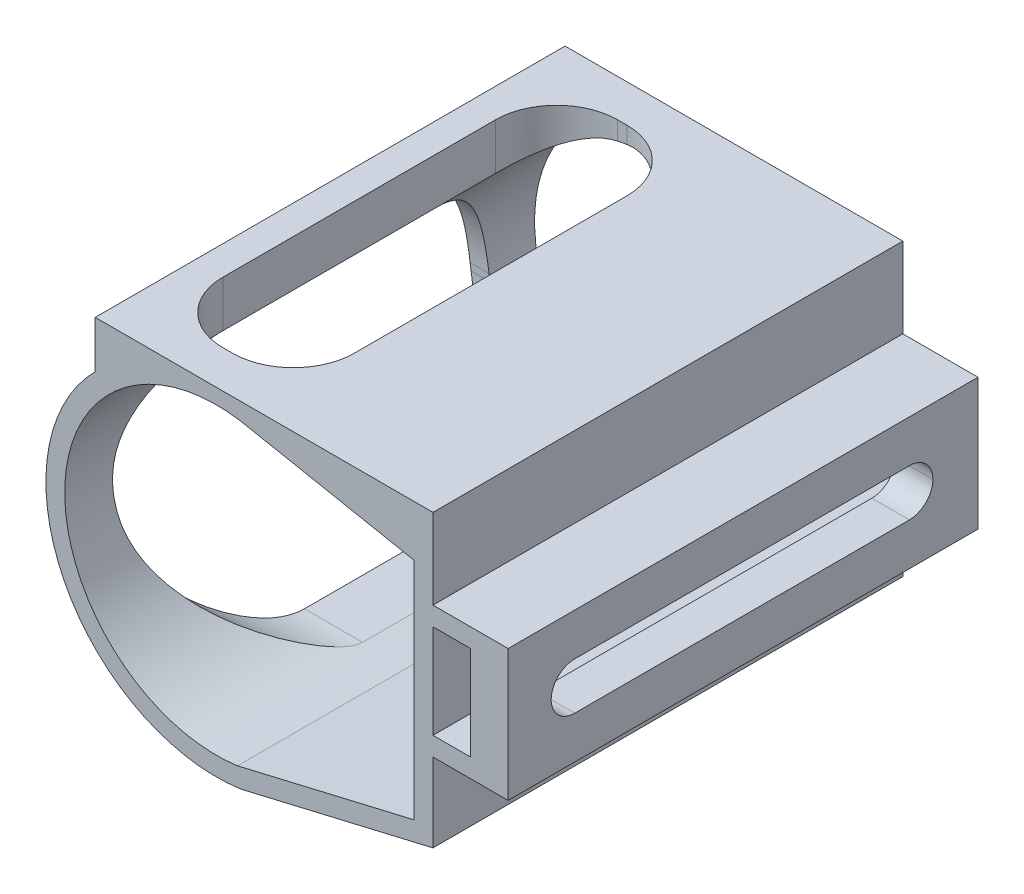
from build123d import *
from OCP.BRepAlgoAPI import BRepAlgoAPI_Cut
from OCP.TopTools import TopTools_ListOfShape

# Parameters (mm, degrees)
SALIENTE_EXTRUIR1_DEPTH     = 50
SALIENTE_EXTRUIR2_DEPTH     = 50
CORTAR_EXTRUIR12_REACH      = 77.399
REDONDEO1_R                 = 2.5
CORTAR_EXTRUIR17_REACH      = 77.931
CORTAR_EXTRUIR17_END_RADIUS = 16.15
CORTAR_EXTRUIR19_REACH      = 79.662
CROQUIS18_W                 = 7
CROQUIS18_H                 = 42
CORTAR_EXTRUIR22_REACH      = 79.662
CORTAR_EXTRUIR22_END_RADIUS = 16.15
CROQUIS22_W                 = 7
CROQUIS22_H                 = 42
REDONDEO10_START            = 3.308867588
REDONDEO10_DEPTH            = 4.936164621
REDONDEO10_START_2          = 6.105712769
REDONDEO10_2_DEPTH          = 2.13931944
REDONDEO10_START_3          = 4
REDONDEO10_3_DEPTH          = 42


with BuildPart() as part:
    # Croquis3 → Saliente-Extruir1 (new body)
    with BuildSketch(Plane.XY):
        with BuildLine():
            Line((-42.099195701, 8.245032209), (-6.157247249, 8.245032209))
            Line((-6.157247249, 8.245032209), (-6.157247249, -22.679560551))
            Line((-6.157247249, -22.679560551), (-26.590955846, -27.481197975))
            ThreePointArc((-26.590955846, -27.481197975), (-45.398833914, -17.697170572), (-42.099195701, 3.245032209))
            Line((-42.099195701, 3.245032209), (-42.099195701, 8.245032209))
        make_face()
        with BuildLine():
            Line((-8.157247249, 2.82108494), (-26.731262437, 6.441781026))
            ThreePointArc((-26.731262437, 6.441781026), (-45.345288804, -9.402744466), (-26.961453667, -25.513783269))
            Line((-26.961453667, -25.513783269), (-8.157247249, -21.095056202))
            Line((-8.157247249, -21.095056202), (-8.157247249, 2.82108494))
        make_face(mode=Mode.SUBTRACT)
    extrude(amount=SALIENTE_EXTRUIR1_DEPTH)

    # Croquis11 → Saliente-Extruir2 (add)
    with BuildSketch(Plane(origin=(0, 0, 0), x_dir=(-1, 0, 0), z_dir=(0, 0, -1))):
        Polygon((-1.842752751, -14.302804028), (-1.842752751, -0.302804028), (6.157247249, -0.302804028), (6.157247249, -2.302804028), (2.157247249, -2.302804028), (2.157247249, -12.302804028), (6.157247249, -12.302804028), (6.157247249, -14.302804028), align=None)
    extrude(amount=-SALIENTE_EXTRUIR2_DEPTH)

    # Cortar-Extruir12: up to this face of the body (flat: up to its plane)
    cortar_extruir12_end = Plane(part.part.faces().sort_by_distance((-8.157247249, -9.136985631, 25))[0])
    # Croquis12 → Cortar-Extruir12 (cut, up to the picked face)
    with BuildSketch(Plane(origin=(1.842752751, 0, 0), x_dir=(0, 0, -1), z_dir=(1, 0, 0)), mode=Mode.PRIVATE) as cortar_extruir12_sk1:
        Polygon((-25, -9.802804028), (-4.8, -9.802804028), (-4.8, -4.802804028), (-45.42287301, -4.802804028), (-45.42287301, -9.802804028), align=None)
    cortar_extruir12_tool1 = split(extrude(cortar_extruir12_sk1.sketch, amount=-CORTAR_EXTRUIR12_REACH, mode=Mode.PRIVATE), bisect_by=cortar_extruir12_end, keep=Keep.BOTH, mode=Mode.PRIVATE)
    add(cortar_extruir12_tool1.solids().sort_by(Axis((1.842753, -7.302804, 25.111437), (-1, 0, 0)))[0], mode=Mode.SUBTRACT)

    # Redondeo1
    redondeo1_edges = [part.edges().sort_by_distance(p)[0] for p in [
        (-0.157247249, -4.802804028, 4.8),
        (-0.157247249, -9.802804028, 4.8),
        (-0.157247249, -9.802804028, 45.42287301),
        (-0.157247249, -4.802804028, 45.42287301),
        (-7.157247249, -9.802804028, 4.8),
        (-7.157247249, -4.802804028, 4.8),
        (-7.157247249, -9.802804028, 45.42287301),
        (-7.157247249, -4.802804028, 45.42287301),
    ]]
    fillet(redondeo1_edges, radius=REDONDEO1_R - 0.0001)  # a hair under: the kernel refuses the full size

    # Cortar-Extruir17: up to this cylinder (the profile starts outside it)
    cortar_extruir17_end = Plane(origin=(-29.1957078, -9.519077631, 25), z_dir=(0, 0, -1)) * Cylinder(CORTAR_EXTRUIR17_END_RADIUS, 189.162, mode=Mode.PRIVATE)
    # Croquis16 → Cortar-Extruir17 (cut, up to the surface)
    with BuildSketch(Plane.ZY.offset(48.157247249), mode=Mode.PRIVATE) as cortar_extruir17_sk1:
        with BuildLine():
            Line((32, -25.481197975), (18, -25.481197975))
            ThreePointArc((18, -25.481197975), (8.807611845, -21.67358613), (5, -12.481197975))
            Line((5, -12.481197975), (5, -11.754967791))
            ThreePointArc((5, -11.754967791), (8.807611845, -2.562579636), (18, 1.245032209))
            Line((18, 1.245032209), (32, 1.245032209))
            ThreePointArc((32, 1.245032209), (41.192388155, -2.562579636), (45, -11.754967791))
            Line((45, -11.754967791), (45, -12.481197975))
            ThreePointArc((45, -12.481197975), (41.192388155, -21.67358613), (32, -25.481197975))
        make_face()
    cortar_extruir17_tool1 = extrude(cortar_extruir17_sk1.sketch, amount=-CORTAR_EXTRUIR17_REACH, mode=Mode.PRIVATE) - cortar_extruir17_end
    add(cortar_extruir17_tool1.solids().sort_by_distance((-48.157247, -12.118083, 25))[0], mode=Mode.SUBTRACT)

    # Croquis18 → Cortar-Extruir19 (cut, up to next)
    with BuildSketch(Plane(origin=(0, 8.245032209, 0), x_dir=(1, 0, 0), z_dir=(0, 1, 0)), mode=Mode.PRIVATE) as cortar_extruir19_sk1:
        with Locations((-28.507247249, -25)):
            Rectangle(CROQUIS18_W, CROQUIS18_H)
    cortar_extruir19_tool1 = extrude(cortar_extruir19_sk1.sketch, amount=-CORTAR_EXTRUIR19_REACH, mode=Mode.PRIVATE) & part.part
    add(cortar_extruir19_tool1.solids().sort_by_distance((-28.507247, 8.245032, 25))[0], mode=Mode.SUBTRACT)

    # Cortar-Extruir22: up to this cylinder (the profile starts outside it)
    cortar_extruir22_end = Plane(origin=(-29.1957078, -9.519077631, 25), z_dir=(0, 0, -1)) * Cylinder(CORTAR_EXTRUIR22_END_RADIUS, 192.624, mode=Mode.PRIVATE)
    # Croquis22 → Cortar-Extruir22 (cut, up to the surface)
    with BuildSketch(Plane(origin=(0, 8.245032209, 0), x_dir=(1, 0, 0), z_dir=(0, 1, 0)), mode=Mode.PRIVATE) as cortar_extruir22_sk1:
        with Locations((-35.507247249, -25)):
            Rectangle(CROQUIS22_W, CROQUIS22_H)
    cortar_extruir22_tool1 = extrude(cortar_extruir22_sk1.sketch, amount=-CORTAR_EXTRUIR22_REACH, mode=Mode.PRIVATE) - cortar_extruir22_end
    add(cortar_extruir22_tool1.solids().sort_by_distance((-35.507247, 8.245032, 25))[0], mode=Mode.SUBTRACT)


with BuildPart() as redondeo10_tool:
    # Redondeo10: read off the stored shape, not the designer's step
    # Redondeo10 outline → Redondeo10 (new body)
    with BuildSketch(Plane(origin=(0, 0, 0), x_dir=(1, 0, 0), z_dir=(0, 1, 0)).offset(REDONDEO10_START)):
        with BuildLine():
            Line((-39.007247249, -4), (-39.007247249, -10.5))
            ThreePointArc((-39.007247249, -10.5), (-37.103441327, -5.903805922), (-32.507247249, -4))
            Line((-32.507247249, -4), (-39.007247249, -4))
        make_face()
        with BuildLine():
            ThreePointArc((-32.507247249, -46), (-37.103441327, -44.096194078), (-39.007247249, -39.5))
            Line((-39.007247249, -39.5), (-39.007247249, -46))
            Line((-39.007247249, -46), (-32.507247249, -46))
        make_face()
    extrude(amount=REDONDEO10_DEPTH)


with BuildPart() as part_1:
    add(part.part)


with BuildPart() as part_2:
    # Redondeo10: joined with redondeo10_tool
    add(part_1.part.fuse(redondeo10_tool.part, tol=0.00001))


with BuildPart() as redondeo10_2_tool:
    # Redondeo10 2 outline → Redondeo10 2 (new body)
    with BuildSketch(Plane(origin=(0, 0, 0), x_dir=(1, 0, 0), z_dir=(0, 1, 0)).offset(REDONDEO10_START_2)):
        with BuildLine():
            Line((-25.007247249, -4), (-31.507247249, -4))
            ThreePointArc((-31.507247249, -4), (-26.911053171, -5.903805922), (-25.007247249, -10.5))
            Line((-25.007247249, -10.5), (-25.007247249, -4))
        make_face()
        with BuildLine():
            ThreePointArc((-25.007247249, -39.5), (-26.911053171, -44.096194078), (-31.507247249, -46))
            Line((-31.507247249, -46), (-25.007247249, -46))
            Line((-25.007247249, -46), (-25.007247249, -39.5))
        make_face()
    extrude(amount=REDONDEO10_2_DEPTH)


with BuildPart() as part_3:
    add(part_2.part)


with BuildPart() as part_4:
    # Redondeo10 2: joined with redondeo10_2_tool
    add(part_3.part.fuse(redondeo10_2_tool.part, tol=0.00001))


with BuildPart() as redondeo10_3_tool:
    # Redondeo10 3 outline → Redondeo10 3 (new body)
    with BuildSketch(Plane.XY.offset(REDONDEO10_START_3)):
        with BuildLine():
            Line((-39.007247249, 3.308868177), (-32.507247249, 3.308867588))
            Line((-32.507247249, 3.308867588), (-32.507247249, 6.287762866))
            ThreePointArc((-32.507247249, 6.287762866), (-35.924173697, 5.162551934), (-39.007247249, 3.308868177))
        make_face()
        with BuildLine():
            Line((-31.507247249, 6.105712769), (-25.007247249, 6.105712769))
            Line((-25.007247249, 6.105712769), (-26.731262437, 6.441781026))
            ThreePointArc((-26.731262437, 6.441781026), (-29.118405097, 6.630737362), (-31.507247249, 6.464641754))
            Line((-31.507247249, 6.464641754), (-31.507247249, 6.105712769))
        make_face()
    extrude(amount=REDONDEO10_3_DEPTH)


with BuildPart() as part_5:
    add(part_4.part)

    # Redondeo10 3: cut by redondeo10_3_tool, with a tolerance
    redondeo10_3_stock = TopTools_ListOfShape()
    redondeo10_3_stock.Append(part_5.part.wrapped)
    redondeo10_3_tools = TopTools_ListOfShape()
    redondeo10_3_tools.Append(redondeo10_3_tool.part.wrapped)
    redondeo10_3_cut = BRepAlgoAPI_Cut()
    redondeo10_3_cut.SetArguments(redondeo10_3_stock)
    redondeo10_3_cut.SetTools(redondeo10_3_tools)
    redondeo10_3_cut.SetFuzzyValue(0.00001)
    redondeo10_3_cut.Build()
    add(Compound.cast(redondeo10_3_cut.Shape()).solids(), mode=Mode.REPLACE)


solid = part_5.part
